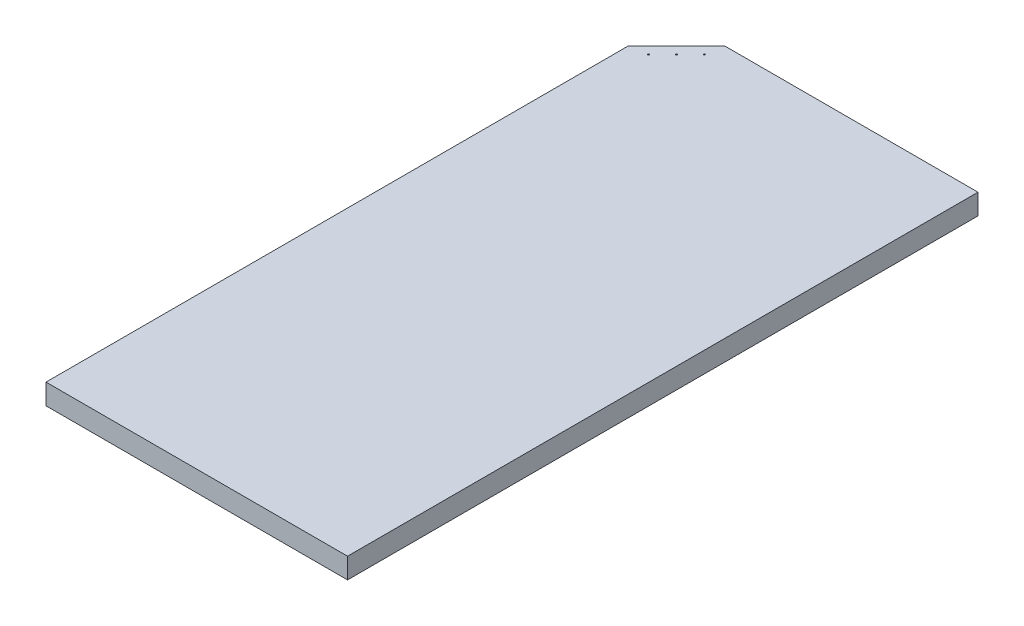
from build123d import *

# Parameters (mm, degrees)
SKETCH1_W               = 279.4
SKETCH1_H               = 584.2
BOSS_EXTRUDE1_DEPTH     = 19.05
CUT_EXTRUDE1_DEPTH      = 475.506199549
CUT_EXTRUDE1_DEPTH_BACK = 475.506199549
SKETCH2_R               = 0.635
CUT_EXTRUDE2_DEPTH      = 475.506199549


with BuildPart() as part:
    # Sketch1 → Boss-Extrude1 (new body)
    with BuildSketch(Plane(origin=(0, 0, 0), x_dir=(1, 0, 0), z_dir=(0, 1, 0))):
        with Locations((0.412094395, -160.847935103)):
            Rectangle(SKETCH1_W, SKETCH1_H)
    extrude(amount=BOSS_EXTRUDE1_DEPTH)

    # Sketch2 → Cut-Extrude1 (cut, two sides: drawn at the far end of the back side and taken through both)
    with BuildSketch(Plane(origin=(0, 19.05, 0), x_dir=(1, 0, 0), z_dir=(0, 1, 0)).offset(-CUT_EXTRUDE1_DEPTH_BACK)):
        with Locations((-110.102073211, 102.066232503)):
            Circle(SKETCH2_R)
        with Locations((-97.170504397, 114.997801318)):
            Circle(SKETCH2_R)
        with Locations((-123.033642026, 89.134663689)):
            Circle(SKETCH2_R)
    extrude(amount=CUT_EXTRUDE1_DEPTH + CUT_EXTRUDE1_DEPTH_BACK, mode=Mode.SUBTRACT)

    # Sketch3 → Cut-Extrude2 (cut, through all)
    with BuildSketch(Plane(origin=(0, 19.05, 0), x_dir=(1, 0, 0), z_dir=(0, 1, 0))):
        Polygon((-139.287905605, 86.350784291), (-94.386624999, 131.252064897), (-139.287905605, 131.252064897), align=None)
    extrude(amount=-CUT_EXTRUDE2_DEPTH, mode=Mode.SUBTRACT)


solid = part.part
